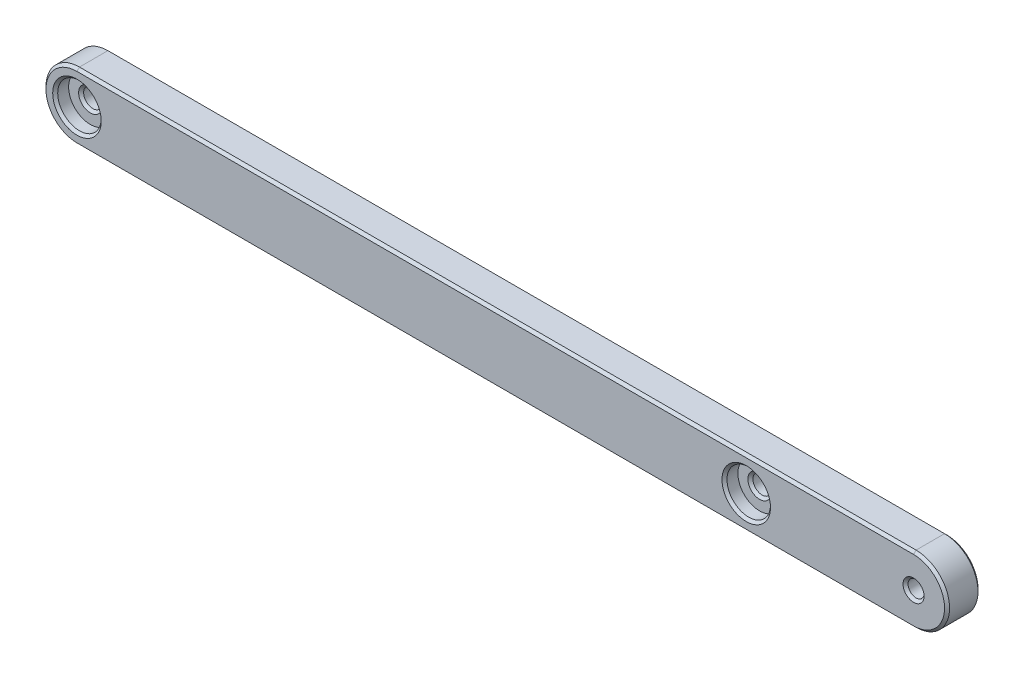
from build123d import *

# Parameters (mm, degrees)
SKETCH1_R           = 2.75
SKETCH1_R_2         = 2.4
BOSS_EXTRUDE1_DEPTH = 10
SKETCH3_R           = 6.5
CUT_EXTRUDE3_DEPTH  = 4
CHAMFER1_SIZE       = 0.75


with BuildPart() as part:
    # Sketch1 → Boss-Extrude1 (new body)
    with BuildSketch(Plane.XY):
        with BuildLine():
            Line((50, 10), (-200, 10))
            ThreePointArc((-200, 10), (-210, 0), (-200, -10))
            Line((-200, -10), (50, -10))
            ThreePointArc((50, -10), (60, 0), (50, 10))
        make_face()
        Circle(SKETCH1_R, mode=Mode.SUBTRACT)
        with Locations((-200, 0)):
            Circle(SKETCH1_R, mode=Mode.SUBTRACT)
        with Locations((50, 0)):
            Circle(SKETCH1_R_2, mode=Mode.SUBTRACT)
    extrude(amount=BOSS_EXTRUDE1_DEPTH)

    # Sketch3 → Cut-Extrude3 (cut)
    with BuildSketch(Plane.XY.offset(10)):
        with Locations((-200, 0)):
            Circle(SKETCH3_R)
        Circle(SKETCH3_R)
    extrude(amount=-CUT_EXTRUDE3_DEPTH, mode=Mode.SUBTRACT)

    # Chamfer1
    chamfer1_edges = [part.edges().sort_by_distance(p)[0] for p in [
        (-202.75, 0, 0),
        (-75, -10, 10),
        (60, 0, 10),
        (-210, 0, 10),
        (-75, 10, 10),
        (-75, -10, 0),
        (60, 0, 0),
        (-210, 0, 0),
        (-75, 10, 0),
        (47.6, 0, 0),
        (47.6, 0, 10),
        (-2.75, 0, 0),
        (-202.75, 0, 6),
        (-2.75, 0, 6),
        (-6.5, 0, 10),
        (-206.5, 0, 10),
    ]]
    chamfer(chamfer1_edges, length=CHAMFER1_SIZE)


solid = part.part
